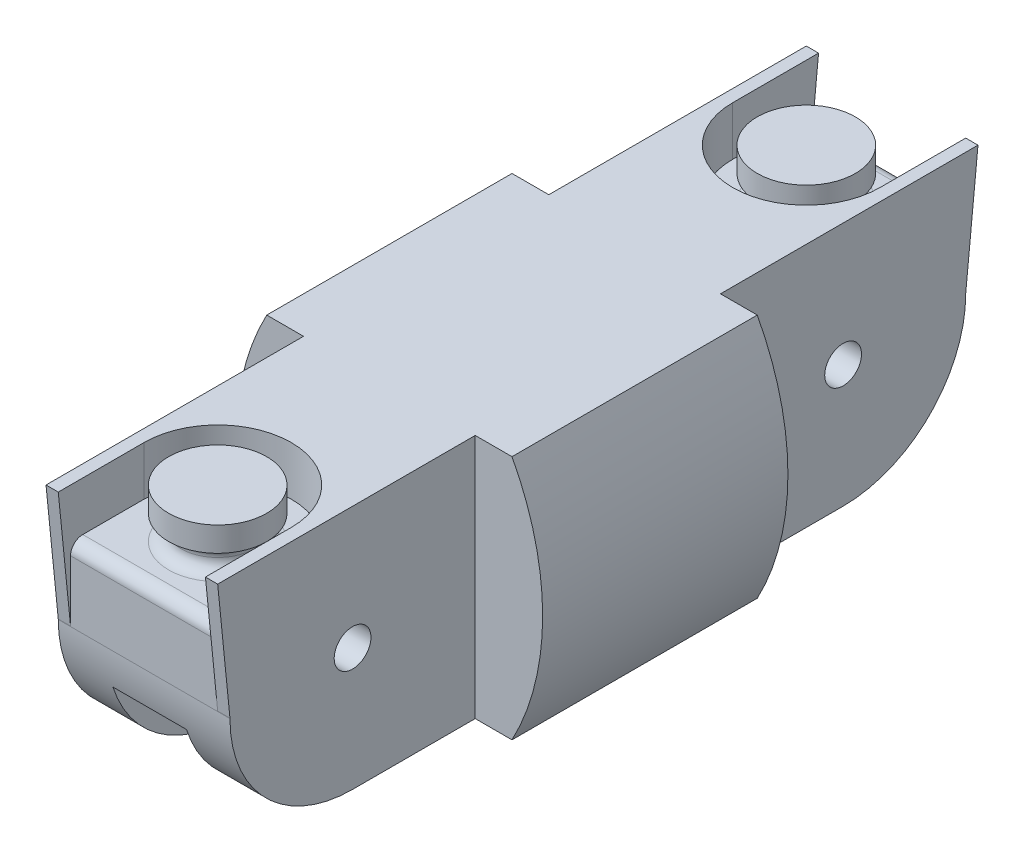
from build123d import *

# Parameters (mm, degrees)
SALIENTE_EXTRUIR1_DEPTH = 20
CROQUIS5_R              = 1.5
CORTAR_EXTRUIR3_DEPTH   = 20
SALIENTE_EXTRUIR2_DEPTH = 20
SALIENTE_EXTRUIR3_DEPTH = 20
CROQUIS4_R              = 1.5
CORTAR_EXTRUIR2_DEPTH   = 14
REDONDEO1_R             = 10
CUT_EXTRUDE1_DEPTH      = 4
SKETCH2_R               = 3
BOSS_EXTRUDE1_DEPTH     = 2
SKETCH3_R               = 4
BOSS_EXTRUDE2_DEPTH     = 2
FILLET1_R               = 1
FILLET2_R               = 1
FILLET3_R               = 1
BOSS_EXTRUDE3_DEPTH     = 1
BOSS_EXTRUDE4_DEPTH     = 1


with BuildPart() as part:
    # Croquis1 → Saliente-Extruir1 (new body)
    with BuildSketch(Plane.XY):
        with BuildLine():
            Line((-10, 10), (10, 10))
            ThreePointArc((10, 10), (12.5, 0), (10, -10))
            Line((10, -10), (-10, -10))
            ThreePointArc((-10, -10), (-12.5, 0), (-10, 10))
        make_face()
    extrude(amount=SALIENTE_EXTRUIR1_DEPTH)

    # Croquis5 → Cortar-Extruir3 (cut)
    with BuildSketch(Plane(origin=(0, 0, 0), x_dir=(-1, 0, 0), z_dir=(0, 0, -1))):
        with Locations((0, -7)):
            Circle(CROQUIS5_R)
    extrude(amount=-CORTAR_EXTRUIR3_DEPTH, mode=Mode.SUBTRACT)

    # Croquis2 → Saliente-Extruir2 (add)
    with BuildSketch(Plane(origin=(0, 0, 0), x_dir=(-1, 0, 0), z_dir=(0, 0, -1))):
        Polygon((-7, 10), (-7, -10), (-3, -10), (-3, -3), (3, -3), (3, -10), (7, -10), (7, 10), align=None)
    extrude(amount=SALIENTE_EXTRUIR2_DEPTH)

    # Croquis3 → Saliente-Extruir3 (add)
    with BuildSketch(Plane.XY.offset(20)):
        Polygon((-7, 10), (-7, -10), (-3, -10), (-3, -3), (3, -3), (3, -10), (7, -10), (7, 10), align=None)
    extrude(amount=SALIENTE_EXTRUIR3_DEPTH)

    # Croquis4 → Cortar-Extruir2 (cut)
    with BuildSketch(Plane.ZY.offset(7)):
        with Locations((-10, 0)):
            Circle(CROQUIS4_R)
        with Locations((30, 0)):
            Circle(CROQUIS4_R)
    extrude(amount=-CORTAR_EXTRUIR2_DEPTH, mode=Mode.SUBTRACT)

    # Redondeo1
    redondeo1_edges = [part.edges().sort_by_distance(p)[0] for p in [
        (-5, -10, 40),
        (-5, -10, -20),
    ]]
    fillet(redondeo1_edges, radius=REDONDEO1_R)

    # Sketch1 → Cut-Extrude1 (cut)
    with BuildSketch(Plane(origin=(0, 10, 0), x_dir=(1, 0, 0), z_dir=(0, 1, 0))):
        with BuildLine():
            Line((-6, 14), (-6, 20))
            Line((-6, 20), (6, 20))
            Line((6, 20), (6, 14))
            ThreePointArc((6, 14), (0, 8), (-6, 14))
        make_face()
        with BuildLine():
            Line((-6, -34), (-6, -40))
            Line((-6, -40), (6, -40))
            Line((6, -40), (6, -34))
            ThreePointArc((6, -34), (0, -28), (-6, -34))
        make_face()
    extrude(amount=-CUT_EXTRUDE1_DEPTH, mode=Mode.SUBTRACT)

    # Sketch2 → Boss-Extrude1 (add)
    with BuildSketch(Plane(origin=(0, 6, 0), x_dir=(1, 0, 0), z_dir=(0, 1, 0))):
        with Locations(Location((0, -34, 0), (0, 0, 270))):
            Circle(SKETCH2_R)
        with Locations(Location((0, 14, 0), (0, 0, 270))):
            Circle(SKETCH2_R)
    extrude(amount=BOSS_EXTRUDE1_DEPTH)

    # Sketch3 → Boss-Extrude2 (add)
    with BuildSketch(Plane(origin=(0, 8, 0), x_dir=(1, 0, 0), z_dir=(0, 1, 0))):
        with Locations(Location((0, -34, 0), (0, 0, 270))):
            Circle(SKETCH3_R)
        with Locations(Location((0, 14, 0), (0, 0, 270))):
            Circle(SKETCH3_R)
    extrude(amount=BOSS_EXTRUDE2_DEPTH)

    # Fillet1
    fillet1_edges = [part.edges().sort_by_distance(p)[0] for p in [
        (0, 6, 31),
        (0, 8, 31),
        (0, 6, -17),
        (0, 8, -17),
    ]]
    fillet(fillet1_edges, radius=FILLET1_R - 0.0001)  # a hair under: the kernel refuses the full size

    # Fillet2
    fillet2_edges = [part.edges().sort_by_distance(p)[0] for p in [
        (0, 6, 40),
        (0, 6, -20),
    ]]
    fillet(fillet2_edges, radius=FILLET2_R)

    # Fillet3
    fillet3_edges = [part.edges().sort_by_distance(p)[0] for p in [
        (1.5, -7, 20),
        (1.5, -7, 0),
    ]]
    fillet(fillet3_edges, radius=FILLET3_R)

    # Sketch5 → Boss-Extrude3 (add)
    with BuildSketch(Plane(origin=(7, 0, 0), x_dir=(0, 0, -1), z_dir=(1, 0, 0))):
        Polygon((20, 10), (21, 10), (19.794177314, -2.018437696), align=None)
        Polygon((-40, 10), (-41, 10), (-39.794177314, -2.018437696), align=None)
    extrude(amount=-BOSS_EXTRUDE3_DEPTH)

    # Sketch6 → Boss-Extrude4 (add)
    with BuildSketch(Plane.ZY.offset(7)):
        Polygon((-20, 10), (-21, 10), (-19.794177314, -2.018437696), align=None)
        Polygon((40, 10), (41, 10), (39.794177314, -2.018437696), align=None)
    extrude(amount=-BOSS_EXTRUDE4_DEPTH)


solid = part.part
